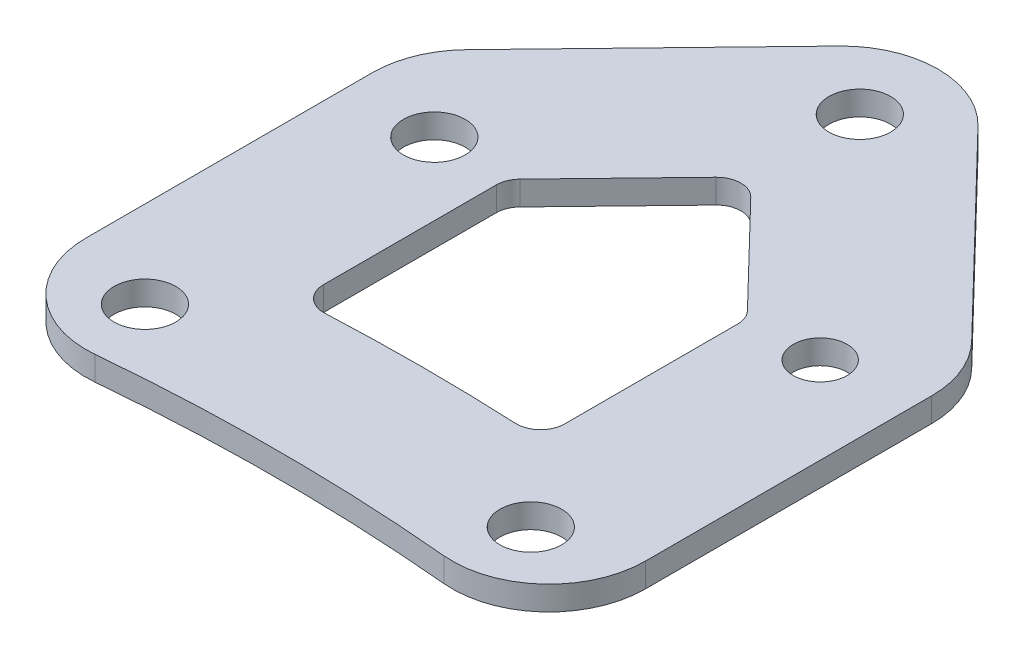
from build123d import *

# Parameters (mm, degrees)
BOSS_EXTRUDE1_DEPTH = 1.5875
SKETCH3_R           = 2.032
SKETCH3_R_2         = 1.778
CUT_EXTRUDE1_DEPTH  = 52.085937461
CUT_EXTRUDE2_DEPTH  = 52.085937461
FILLET1_R           = 6.35
FILLET2_R           = 1.5875


with BuildPart() as part:
    # Sketch1 → Boss-Extrude1 (new body)
    with BuildSketch(Plane(origin=(0, 0, 0), x_dir=(1, 0, 0), z_dir=(0, 1, 0))):
        with BuildLine():
            Line((0, 0), (18.415, -19.05))
            Line((18.415, -19.05), (18.415, -47.625))
            ThreePointArc((18.415, -47.625), (0, -46.266231115), (-18.415, -47.625))
            Line((-18.415, -47.625), (-18.415, -19.05))
            Line((-18.415, -19.05), (0, 0))
        make_face()
    extrude(amount=BOSS_EXTRUDE1_DEPTH)

    # Sketch3 → Cut-Extrude1 (cut, through all)
    with BuildSketch(Plane(origin=(0, 1.5875, 0), x_dir=(1, 0, 0), z_dir=(0, 1, 0))):
        with Locations((12.7, -42.294109534)):
            Circle(SKETCH3_R)
        with Locations((-12.7, -42.294109534)):
            Circle(SKETCH3_R)
        with Locations((-12.7, -23.244109534)):
            Circle(SKETCH3_R)
        with Locations((12.7, -23.244109534)):
            Circle(SKETCH3_R_2)
        with Locations((0, -7.9375)):
            Circle(SKETCH3_R)
    extrude(amount=-CUT_EXTRUDE1_DEPTH, mode=Mode.SUBTRACT)

    # Sketch4 → Cut-Extrude2 (cut, through all)
    with BuildSketch(Plane(origin=(0, 1.5875, 0), x_dir=(1, 0, 0), z_dir=(0, 1, 0))):
        with BuildLine():
            Line((7.9375, -36.974796609), (7.9375, -23.286267168))
            Line((7.9375, -23.286267168), (0, -15.075060272))
            Line((0, -15.075060272), (-7.9375, -23.286267168))
            Line((-7.9375, -23.286267168), (-7.9375, -36.974796609))
            ThreePointArc((-7.9375, -36.974796609), (0, -36.741231115), (7.9375, -36.974796609))
        make_face()
    extrude(amount=-CUT_EXTRUDE2_DEPTH, mode=Mode.SUBTRACT)

    # Fillet1
    fillet1_edges = [part.edges().sort_by_distance(p)[0] for p in [
        (-18.415, 0.79375, 47.625),
        (18.415, 0.79375, 47.625),
        (18.415, 0.79375, 19.05),
        (-18.415, 0.79375, 19.05),
        (0, 0.79375, 0),
    ]]
    fillet(fillet1_edges, radius=FILLET1_R)

    # Fillet2
    fillet2_edges = [part.edges().sort_by_distance(p)[0] for p in [
        (-7.9375, 0.79375, 36.974796609),
        (7.9375, 0.79375, 36.974796609),
        (7.9375, 0.79375, 23.286267168),
        (-7.9375, 0.79375, 23.286267168),
        (0, 0.79375, 15.075060272),
    ]]
    fillet(fillet2_edges, radius=FILLET2_R)


solid = part.part
